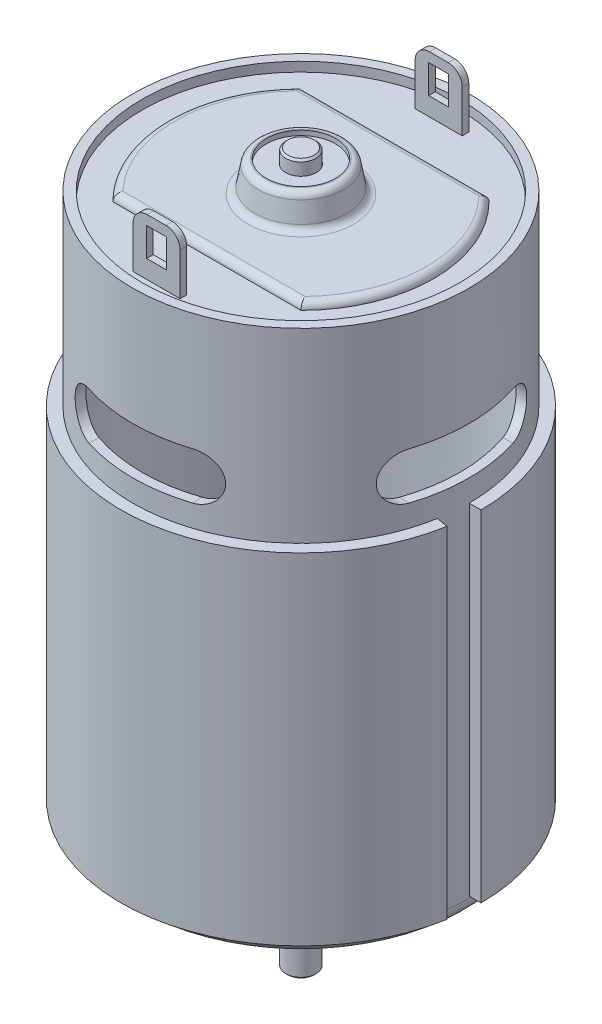
from build123d import *

# Parameters (mm, degrees)
SKETCH1_R                 = 17.9
BOSS_EXTRUDE1_DEPTH       = 58
SKETCH8_W                 = 16.9
SKETCH8_H                 = 55
SKETCH2_W                 = 1.25
SKETCH2_H                 = 36.2
REVOLVE1_ANGLE            = 350
SKETCH3_R                 = 6.5
BOSS_EXTRUDE2_DEPTH       = 4
SKETCH9_R                 = 16.9
CUT_EXTRUDE3_DEPTH        = 1
BOSS_EXTRUDE5_DEPTH       = 0.75
SKETCH13_R                = 5
BOSS_EXTRUDE6_DEPTH       = 3.25
BOSS_EXTRUDE6_TAPER       = 10
SKETCH14_W                = 5
SKETCH14_H                = 0.7
BOSS_EXTRUDE7_DEPTH       = 6
SKETCH16_W                = 2.126840128
SKETCH16_H                = 3.040675208
CUT_EXTRUDE5_DEPTH        = 0.7
CUT_EXTRUDE1_DEPTH        = 69.574375681
CIRPATTERN1_COUNT         = 2
CIRPATTERN1_ANGLE         = 90
CUT_EXTRUDE2_DEPTH        = 20
SKETCH11_R                = 1.5
CUT_EXTRUDE4_DEPTH        = 1
SKETCH17_R                = 5.3
CUT_EXTRUDE6_DEPTH        = 5
SKETCH18_R                = 5.3
BOSS_EXTRUDE8_DEPTH       = 4.5
SKETCH19_R                = 3.676937313
CUT_EXTRUDE7_DEPTH        = 5
SKETCH20_R                = 3.676937313
BOSS_EXTRUDE9_DEPTH       = 4.5
SKETCH22_R                = 1.625
CUT_EXTRUDE8_DEPTH        = 72.803168454
BOSS_EXTRUDE10_DEPTH      = 10
BOSS_EXTRUDE10_DEPTH_BACK = 65.5
SKETCH21_R                = 1.6
FILLET2_R                 = 1.8
FILLET3_R                 = 0.75
FILLET4_R                 = 0.75
FILLET5_R                 = 1.5
CHAMFER1_SIZE             = 0.2
CHAMFER2_SIZE             = 0.1


with BuildPart() as part:
    # Sketch1 → Boss-Extrude1 (new body)
    with BuildSketch(Plane(origin=(0, 0, 0), x_dir=(1, 0, 0), z_dir=(0, 1, 0))):
        with Locations(Location((0, 0, 0), (0, 0, 90))):
            Circle(SKETCH1_R)
    extrude(amount=BOSS_EXTRUDE1_DEPTH)

    # Sketch8 → Cut-Revolve2 (revolve, cut)
    with BuildSketch(Plane.XY, mode=Mode.PRIVATE) as cut_revolve2_sk:
        with Locations((8.45, 28.5)):
            Rectangle(SKETCH8_W, SKETCH8_H)
    revolve(cut_revolve2_sk.sketch.rotate(Axis((0, 56, 0), (0, -1, 0)), 180), axis=Axis((0, 56, 0), (0, -1, 0)), mode=Mode.SUBTRACT)

    # Sketch3 → Boss-Extrude2 (add)
    with BuildSketch(Plane.XZ):
        with Locations(Location((0, 0, 0), (0, 0, 270))):
            Circle(SKETCH3_R)
    extrude(amount=BOSS_EXTRUDE2_DEPTH)

    # Sketch9 → Cut-Extrude3 (cut)
    with BuildSketch(Plane(origin=(0, 58, 0), x_dir=(1, 0, 0), z_dir=(0, 1, 0))):
        with Locations(Location((0, 0, 0), (0, 0, 270))):
            Circle(SKETCH9_R)
    extrude(amount=-CUT_EXTRUDE3_DEPTH, mode=Mode.SUBTRACT)

    # Sketch12 → Boss-Extrude5 (add)
    with BuildSketch(Plane(origin=(0, 57, 0), x_dir=(1, 0, 0), z_dir=(0, 1, 0))):
        with BuildLine():
            Line((-10, 10), (10, 10))
            ThreePointArc((10, 10), (14.142135624, 0), (10, -10))
            Line((10, -10), (-10, -10))
            ThreePointArc((-10, -10), (-14.142135624, 0), (-10, 10))
        make_face()
    extrude(amount=BOSS_EXTRUDE5_DEPTH)

    # Sketch13 → Boss-Extrude6 (add)
    with BuildSketch(Plane(origin=(0, 57.75, 0), x_dir=(1, 0, 0), z_dir=(0, 1, 0))):
        Circle(SKETCH13_R)
    extrude(amount=BOSS_EXTRUDE6_DEPTH, taper=BOSS_EXTRUDE6_TAPER)

    # Sketch14 → Boss-Extrude7 (add)
    with BuildSketch(Plane(origin=(0, 57, 0), x_dir=(1, 0, 0), z_dir=(0, 1, 0))):
        with Locations((0, 15)):
            Rectangle(SKETCH14_W, SKETCH14_H)
    boss_extrude7 = extrude(amount=BOSS_EXTRUDE7_DEPTH)

    # Sketch16 → Cut-Extrude5 (cut)
    with BuildSketch(Plane(origin=(0, 0, -15.35), x_dir=(-1, 0, 0), z_dir=(0, 0, -1))):
        with Locations((0, 60.447523229)):
            Rectangle(SKETCH16_W, SKETCH16_H)
    cut_extrude5 = extrude(amount=-CUT_EXTRUDE5_DEPTH, mode=Mode.SUBTRACT)

    # Mirror3: Boss-Extrude7, Cut-Extrude5 across plane
    add(boss_extrude7.mirror(Plane.XY))
    add(cut_extrude5.mirror(Plane.XY), mode=Mode.SUBTRACT)

    # Sketch5 → Cut-Extrude1 (cut, symmetric)
    with BuildSketch(Plane.XY):
        with BuildLine():
            Line((-5.5, 45.528198613), (5.5, 45.528198613))
            ThreePointArc((5.5, 45.528198613), (8, 43.028198613), (5.5, 40.528198613))
            Line((5.5, 40.528198613), (-5.5, 40.528198613))
            ThreePointArc((-5.5, 40.528198613), (-8, 43.028198613), (-5.5, 45.528198613))
        make_face()
    cut_extrude1 = extrude(amount=CUT_EXTRUDE1_DEPTH, both=True, mode=Mode.SUBTRACT)

    # CirPattern1: Cut-Extrude1 ×2 about axis
    cirpattern1_axis = Axis((0, 58, 0), (0, -1, 0))
    for i in range(1, CIRPATTERN1_COUNT):
        add(cut_extrude1.rotate(cirpattern1_axis, i * CIRPATTERN1_ANGLE / (CIRPATTERN1_COUNT - 1)), mode=Mode.SUBTRACT)

    # Sketch6 → Cut-Extrude2 (cut)
    with BuildSketch(Plane.XZ):
        with BuildLine():
            Line((-5.980048404, 12.824255187), (-4.712193618, 10.105331825))
            ThreePointArc((-4.712193618, 10.105331825), (0, 11.15), (4.712193618, 10.105331825))
            Line((4.712193618, 10.105331825), (5.980048404, 12.824255187))
            ThreePointArc((5.980048404, 12.824255187), (0, 14.15), (-5.980048404, 12.824255187))
        make_face()
        with BuildLine():
            Line((10.105331825, -4.712193618), (12.824255187, -5.980048404))
            ThreePointArc((12.824255187, -5.980048404), (14.15, 0), (12.824255187, 5.980048404))
            Line((12.824255187, 5.980048404), (10.105331825, 4.712193618))
            ThreePointArc((10.105331825, 4.712193618), (11.15, 0), (10.105331825, -4.712193618))
        make_face()
        with BuildLine():
            Line((-4.712193618, -10.105331825), (-5.980048404, -12.824255187))
            ThreePointArc((-5.980048404, -12.824255187), (0, -14.15), (5.980048404, -12.824255187))
            Line((5.980048404, -12.824255187), (4.712193618, -10.105331825))
            ThreePointArc((4.712193618, -10.105331825), (0, -11.15), (-4.712193618, -10.105331825))
        make_face()
        with BuildLine():
            Line((-10.105331825, 4.712193618), (-12.824255187, 5.980048404))
            ThreePointArc((-12.824255187, 5.980048404), (-14.15, 0), (-12.824255187, -5.980048404))
            Line((-12.824255187, -5.980048404), (-10.105331825, -4.712193618))
            ThreePointArc((-10.105331825, -4.712193618), (-11.15, 0), (-10.105331825, 4.712193618))
        make_face()
    extrude(amount=-CUT_EXTRUDE2_DEPTH, mode=Mode.SUBTRACT)

    # Sketch11 → Cut-Extrude4 (cut)
    with BuildSketch(Plane.XZ):
        with Locations(Location((9.192388155, 9.192388155, 0), (0, 0, 270))):
            Circle(SKETCH11_R)
        with Locations(Location((9.192388155, -9.192388155, 0), (0, 0, 270))):
            Circle(SKETCH11_R)
        with Locations(Location((-9.192388155, -9.192388155, 0), (0, 0, 270))):
            Circle(SKETCH11_R)
        with Locations(Location((-9.192388155, 9.192388155, 0), (0, 0, 270))):
            Circle(SKETCH11_R)
    extrude(amount=-CUT_EXTRUDE4_DEPTH, mode=Mode.SUBTRACT)

    # Sketch17 → Cut-Extrude6 (cut)
    with BuildSketch(Plane.XZ.offset(4)):
        with Locations(Location((0, 0, 0), (0, 0, 270))):
            Circle(SKETCH17_R)
    extrude(amount=-CUT_EXTRUDE6_DEPTH, mode=Mode.SUBTRACT)

    # Sketch19 → Cut-Extrude7 (cut)
    with BuildSketch(Plane(origin=(0, 61, 0), x_dir=(1, 0, 0), z_dir=(0, 1, 0))):
        with Locations(Location((0, 0, 0), (0, 0, 270))):
            Circle(SKETCH19_R)
    extrude(amount=-CUT_EXTRUDE7_DEPTH, mode=Mode.SUBTRACT)

    # Fillet2
    fillet2_edges = [part.edges().sort_by_distance(p)[0] for p in [
        (0, 0, 17.9),
    ]]
    fillet(fillet2_edges, radius=FILLET2_R)

    # Fillet3
    fillet3_edges = [part.edges().sort_by_distance(p)[0] for p in [
        (-9.192388155, 0, 10.692388155),
        (-9.192388155, 0, -7.692388155),
        (9.192388155, 0, -7.692388155),
        (9.192388155, 0, 10.692388155),
        (0, 0, 6.5),
        (0, -4, 6.5),
    ]]
    fillet(fillet3_edges, radius=FILLET3_R)

    # Fillet4
    fillet4_edges = [part.edges().sort_by_distance(p)[0] for p in [
        (0, 57.75, -10),
        (14.142135624, 57.75, 0),
        (0, 57.75, 10),
        (-14.142135624, 57.75, 0),
        (-5, 57.75, 0),
        (-4.426937313, 61, 0),
    ]]
    fillet(fillet4_edges, radius=FILLET4_R - 0.0001)  # a hair under: the kernel refuses the full size

    # Fillet5
    fillet5_edges = [part.edges().sort_by_distance(p)[0] for p in [
        (-2.5, 63, -15),
        (2.5, 63, -15),
        (-2.5, 63, 15),
        (2.5, 63, 15),
    ]]
    fillet(fillet5_edges, radius=FILLET5_R)


with BuildPart() as body_2:
    # Sketch2 → Revolve1 (revolve)
    with BuildSketch(Plane.XY):
        with Locations((18.525, 20.1)):
            Rectangle(SKETCH2_W, SKETCH2_H)
    revolve(axis=Axis((0, 0, 0), (0, 1, 0)), revolution_arc=REVOLVE1_ANGLE)


with BuildPart() as body_3:
    # Sketch18 → Boss-Extrude8 (new body)
    with BuildSketch(Plane(origin=(0, 1, 0), x_dir=(1, 0, 0), z_dir=(0, 1, 0))):
        with Locations(Location((0, 0, 0), (0, 0, 180))):
            Circle(SKETCH18_R)
    extrude(amount=-BOSS_EXTRUDE8_DEPTH)


with BuildPart() as body_4:
    # Sketch20 → Boss-Extrude9 (new body)
    with BuildSketch(Plane.XZ.offset(-56)):
        Circle(SKETCH20_R)
    extrude(amount=-BOSS_EXTRUDE9_DEPTH)


with BuildPart() as cut_extrude8_tool:
    # Sketch22 → Cut-Extrude8 (new, through all)
    with BuildSketch(Plane.XZ.offset(3.5)):
        Circle(SKETCH22_R)
    extrude(amount=-CUT_EXTRUDE8_DEPTH)


with BuildPart() as body_3_1:
    add(body_3.part)

    # Cut-Extrude8: cut by cut_extrude8_tool
    add(cut_extrude8_tool.part, mode=Mode.SUBTRACT)

    # Chamfer2
    chamfer2_edges = [body_3_1.edges().sort_by_distance(p)[0] for p in [
        (-1.625, -3.5, 0),
    ]]
    chamfer(chamfer2_edges, length=CHAMFER2_SIZE)


with BuildPart() as body_4_1:
    add(body_4.part)

    # Cut-Extrude8: cut by cut_extrude8_tool
    add(cut_extrude8_tool.part, mode=Mode.SUBTRACT)


with BuildPart() as body_5:
    # Sketch21 → Boss-Extrude10 (new, two sides: drawn at the far end of the back side and taken through both)
    with BuildSketch(Plane.XZ.offset(3.5).offset(-BOSS_EXTRUDE10_DEPTH_BACK)):
        Circle(SKETCH21_R)
    extrude(amount=BOSS_EXTRUDE10_DEPTH + BOSS_EXTRUDE10_DEPTH_BACK)

    # Chamfer1
    chamfer1_edges = [body_5.edges().sort_by_distance(p)[0] for p in [
        (-1.6, -13.5, 0),
        (-1.6, 62, 0),
    ]]
    chamfer(chamfer1_edges, length=CHAMFER1_SIZE)


solid = Compound([part.part, body_2.part, body_3_1.part, body_4_1.part, body_5.part])
